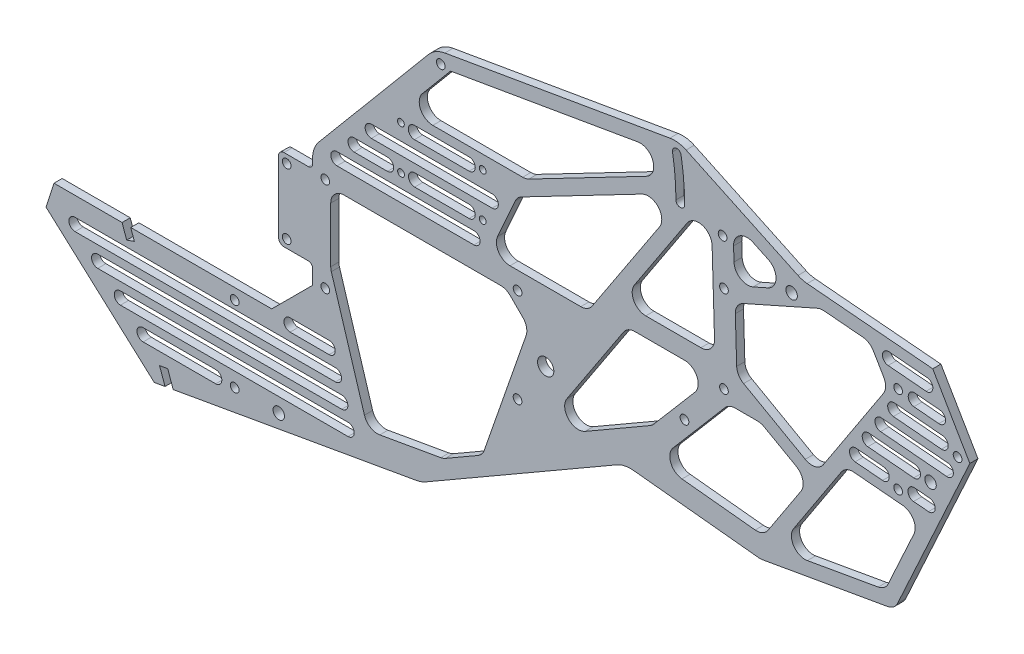
from build123d import *

# Parameters (mm, degrees)
SKETCH1_R           = 1.6
SKETCH1_R_2         = 3
SKETCH1_R_3         = 2.1
BOSS_EXTRUDE1_DEPTH = 3
CUT_EXTRUDE1_DEPTH  = 3
CUT_EXTRUDE2_DEPTH  = 3
SKETCH4_R           = 1.6
SKETCH4_R_2         = 1.25
CUT_EXTRUDE3_DEPTH  = 3
SKETCH5_R           = 1.6
SKETCH5_R_2         = 2.1
CUT_EXTRUDE4_DEPTH  = 3
CUT_EXTRUDE5_DEPTH  = 3
CUT_EXTRUDE6_DEPTH  = 3
FILLET1_R           = 5
FILLET2_R           = 5


with BuildPart() as part:
    # Sketch1 → Boss-Extrude1 (new body)
    with BuildSketch(Plane.XY):
        with BuildLine():
            Line((33.606433282, 69.354528427), (33.606433282, 67.494230769))
            ThreePointArc((33.606433282, 67.494230769), (33.167093454, 66.433570597), (32.106433282, 65.994230769))
            Line((32.106433282, 65.994230769), (23.106433282, 65.994230769))
            ThreePointArc((23.106433282, 65.994230769), (21.692219719, 65.408444332), (21.106433282, 63.994230769))
            Line((21.106433282, 63.994230769), (21.106433282, 37.994230769))
            ThreePointArc((21.106433282, 37.994230769), (21.692219719, 36.580017207), (23.106433282, 35.994230769))
            Line((23.106433282, 35.994230769), (32.106433282, 35.994230769))
            ThreePointArc((32.106433282, 35.994230769), (33.167093454, 35.554890941), (33.606433282, 34.494230769))
            Line((33.606433282, 34.494230769), (33.606433282, 28.994230769))
            Line((33.606433282, 28.994230769), (18.606433282, 13.994230769))
            Line((18.606433282, 13.994230769), (-33.208685877, 13.994230769))
            Line((-33.208685877, 13.994230769), (-31.865678416, 10.226428896))
            Line((-31.865678416, 10.226428896), (-34.691529821, 9.2191733))
            Line((-34.691529821, 9.2191733), (-36.393566718, 13.994230769))
            Line((-36.393566718, 13.994230769), (-61.393566718, 13.994230769))
            Line((-61.393566718, 13.994230769), (-64.338240595, 4.931456458))
            Line((-64.338240595, 4.931456458), (-24.540435349, -31.005769231))
            Line((-24.540435349, -31.005769231), (-20.601204337, -30.31117652))
            Line((-20.601204337, -30.31117652), (-22.615715529, -24.65947371))
            Line((-22.615715529, -24.65947371), (-19.619169292, -24.131101759))
            Line((-19.619169292, -24.131101759), (-17.604658099, -29.782804569))
            Line((-17.604658099, -29.782804569), (71.833626772, -14.012421838))
            ThreePointArc((71.833626772, -14.012421838), (73.517346428, -13.561270516), (75.097144995, -12.824598346))
            Line((75.097144995, -12.824598346), (145.414901265, 27.773377165))
            ThreePointArc((145.414901265, 27.773377165), (148.329156871, 28.893188072), (151.446707108, 29.059749526))
            Line((151.446707108, 29.059749526), (212.432702142, 22.733412992))
            ThreePointArc((212.432702142, 22.733412992), (215.302065541, 21.994439853), (217.828932512, 20.447096669))
            ThreePointArc((217.828932512, 20.447096669), (261.451176936, 21.093233821), (267.109241255, 64.351805341))
            ThreePointArc((267.109241255, 64.351805341), (265.48687235, 69.095784942), (266.370965215, 74.030944831))
            Line((266.370965215, 74.030944831), (275.117398408, 93.06941092))
            Line((275.117398408, 93.06941092), (261.484759484, 116.375014451))
            Line((261.484759484, 116.375014451), (215.3420672, 120.41197693))
            ThreePointArc((215.3420672, 120.41197693), (213.606741864, 120.719693633), (211.952387443, 121.327274937))
            Line((211.952387443, 121.327274937), (170.861805565, 140.682145004))
            ThreePointArc((170.861805565, 140.682145004), (167.944202702, 141.544817238), (164.902224852, 141.490222269))
            Line((164.902224852, 141.490222269), (82.210010789, 127.239213849))
            ThreePointArc((82.210010789, 127.239213849), (78.925127101, 126.054403786), (76.247909886, 123.812363706))
            Line((76.247909886, 123.812363706), (35.945988851, 75.782404523))
            ThreePointArc((35.945988851, 75.782404523), (34.209507074, 72.77472986), (33.606433282, 69.354528427))
        make_face()
        with Locations((5, -17.865711058)):
            Circle(SKETCH1_R, mode=Mode.SUBTRACT)
        with Locations((5, 9.994230769)):
            Circle(SKETCH1_R, mode=Mode.SUBTRACT)
        with Locations((24.106433282, 38.994230769)):
            Circle(SKETCH1_R, mode=Mode.SUBTRACT)
        with Locations((38.27641453, 30.394230769)):
            Circle(SKETCH1_R, mode=Mode.SUBTRACT)
        with Locations((24.106433282, 62.994230769)):
            Circle(SKETCH1_R, mode=Mode.SUBTRACT)
        with Locations((38.27641453, 64.994230769)):
            Circle(SKETCH1_R, mode=Mode.SUBTRACT)
        with Locations((80.724281303, 122.924200116)):
            Circle(SKETCH1_R, mode=Mode.SUBTRACT)
        with Locations((108.936452034, 30.394230769)):
            Circle(SKETCH1_R, mode=Mode.SUBTRACT)
        with Locations((119.266433282, 45.994230769)):
            Circle(SKETCH1_R_2, mode=Mode.SUBTRACT)
        with Locations((108.936452034, 64.994230769)):
            Circle(SKETCH1_R, mode=Mode.SUBTRACT)
        with Locations((21.186685258, -17.865711058)):
            Circle(SKETCH1_R_3, mode=Mode.SUBTRACT)
        with BuildLine():
            Line((-2, -20.135652886), (-28.647304351, -20.135652886))
            ThreePointArc((-28.647304351, -20.135652886), (-30.917246179, -17.865711058), (-28.647304351, -15.595769231))
            Line((-28.647304351, -15.595769231), (-2, -15.595769231))
            ThreePointArc((-2, -15.595769231), (0.269941827, -17.865711058), (-2, -20.135652886))
        make_face(mode=Mode.SUBTRACT)
        with BuildLine():
            Line((46.626657738, -12.605652886), (-36.986219439, -12.605652886))
            ThreePointArc((-36.986219439, -12.605652886), (-39.256161266, -10.335711058), (-36.986219439, -8.065769231))
            Line((-36.986219439, -8.065769231), (46.626657738, -8.065769231))
            ThreePointArc((46.626657738, -8.065769231), (48.896599565, -10.335711058), (46.626657738, -12.605652886))
        make_face(mode=Mode.SUBTRACT)
        with BuildLine():
            Line((44.309159487, -5.075652886), (-45.325134526, -5.075652886))
            ThreePointArc((-45.325134526, -5.075652886), (-47.595076354, -2.805711058), (-45.325134526, -0.535769231))
            Line((-45.325134526, -0.535769231), (44.309159487, -0.535769231))
            ThreePointArc((44.309159487, -0.535769231), (46.579101315, -2.805711058), (44.309159487, -5.075652886))
        make_face(mode=Mode.SUBTRACT)
        with BuildLine():
            Line((41.991661236, 2.454347114), (-53.664049614, 2.454347114))
            ThreePointArc((-53.664049614, 2.454347114), (-55.933991441, 4.724288942), (-53.664049614, 6.994230769))
            Line((-53.664049614, 6.994230769), (41.991661236, 6.994230769))
            ThreePointArc((41.991661236, 6.994230769), (44.261603064, 4.724288942), (41.991661236, 2.454347114))
        make_face(mode=Mode.SUBTRACT)
        with BuildLine():
            Line((39.674162986, 9.984347114), (25.351772829, 9.984347114))
            ThreePointArc((25.351772829, 9.984347114), (23.081831001, 12.254288942), (25.351772829, 14.524230769))
            Line((25.351772829, 14.524230769), (39.674162986, 14.524230769))
            ThreePointArc((39.674162986, 14.524230769), (41.944104813, 12.254288942), (39.674162986, 9.984347114))
        make_face(mode=Mode.SUBTRACT)
        with BuildLine():
            Line((112.062626277, 52.219115126), (96.660010447, 7.956769522))
            ThreePointArc((96.660010447, 7.956769522), (95.790683483, 6.413353898), (94.437758812, 5.269913478))
            Line((94.437758812, 5.269913478), (82.378204185, -1.692673633))
            ThreePointArc((82.378204185, -1.692673633), (81.588304901, -2.061009718), (80.746445073, -2.286585379))
            Line((80.746445073, -2.286585379), (58.320914344, -6.240811503))
            ThreePointArc((58.320914344, -6.240811503), (54.844152372, -5.582404902), (52.673881025, -2.787535434))
            Line((52.673881025, -2.787535434), (40.497622099, 36.775484596))
            ThreePointArc((40.497622099, 36.775484596), (40.332025682, 37.50259487), (40.27641453, 38.246247292))
            Line((40.27641453, 38.246247292), (40.27641453, 58.494230769))
            ThreePointArc((40.27641453, 58.494230769), (41.740880624, 62.029764675), (45.27641453, 63.494230769))
            Line((45.27641453, 63.494230769), (102.708529973, 63.494230769))
            ThreePointArc((102.708529973, 63.494230769), (104.621947134, 63.113628432), (106.244063878, 62.029764675))
            Line((106.244063878, 62.029764675), (110.875908547, 57.397920006))
            ThreePointArc((110.875908547, 57.397920006), (112.214055028, 54.97918487), (112.062626277, 52.219115126))
        make_face(mode=Mode.SUBTRACT)
        with BuildLine():
            ThreePointArc((167.124281303, 122.924200116), (168.724281303, 121.324200116), (170.324281303, 122.924200116))
            ThreePointArc((170.324281303, 122.924200116), (169.998274999, 130.560563753), (169.02262841, 138.141358133))
            ThreePointArc((169.02262841, 138.141358133), (167.174137247, 139.446379366), (165.869116014, 137.597888204))
            ThreePointArc((165.869116014, 137.597888204), (166.809918081, 130.28783648), (167.124281303, 122.924200116))
        make_face(mode=Mode.SUBTRACT)
    extrude(amount=BOSS_EXTRUDE1_DEPTH)

    # Sketch2 → Cut-Extrude1 (cut)
    with BuildSketch(Plane.XY.offset(3)):
        Polygon((151.446707108, 29.059749526), (241.422875717, 19.726139041), (275.117398408, 93.06941092), (318.53181197, -44.262654747), align=None)
    extrude(amount=-CUT_EXTRUDE1_DEPTH, mode=Mode.SUBTRACT)

    # Sketch3 → Cut-Extrude2 (cut)
    with BuildSketch(Plane.XY.offset(3)):
        Polygon((198.229692038, 24.206751611), (247.470079689, 32.889160494), (241.422875717, 19.726139041), align=None)
    extrude(amount=-CUT_EXTRUDE2_DEPTH, mode=Mode.SUBTRACT)

    # Sketch4 → Cut-Extrude3 (cut)
    with BuildSketch(Plane.XY.offset(3)):
        with Locations((184.767611591, 103.568989757)):
            Circle(SKETCH4_R)
        with Locations((184.767611591, 71.568989757)):
            Circle(SKETCH4_R)
        with Locations((248.767611591, 103.568989757)):
            Circle(SKETCH4_R)
        with Locations((248.767611591, 71.568989757)):
            Circle(SKETCH4_R)
        with Locations((66.057748953, 96.994230769)):
            Circle(SKETCH4_R_2)
        with Locations((96.120516229, 96.994230769)):
            Circle(SKETCH4_R_2)
        with Locations((66.120516229, 80.994230769)):
            Circle(SKETCH4_R_2)
        with Locations((96.120516229, 80.994230769)):
            Circle(SKETCH4_R_2)
    extrude(amount=-CUT_EXTRUDE3_DEPTH, mode=Mode.SUBTRACT)

    # Sketch5 → Cut-Extrude4 (cut)
    with BuildSketch(Plane.XY.offset(3)):
        with Locations((184.267611591, 120.119180009)):
            Circle(SKETCH5_R)
        with Locations((170.267611591, 54.568989757)):
            Circle(SKETCH5_R)
        with Locations((270.61335305, 92.847113196)):
            Circle(SKETCH5_R)
        with Locations((209.641360773, 114.61683213)):
            Circle(SKETCH5_R_2)
        with Locations((260.685601414, 79.876300594)):
            Circle(SKETCH5_R_2)
    extrude(amount=-CUT_EXTRUDE4_DEPTH, mode=Mode.SUBTRACT)

    # Sketch6 → Cut-Extrude5 (cut)
    with BuildSketch(Plane.XY.offset(3)):
        with BuildLine():
            Line((134.85979926, 71.494230769), (98.461835392, 71.494230769))
            Line((98.461835392, 71.494230769), (108.765182202, 94.659315822))
            Line((108.765182202, 94.659315822), (154.610313298, 118.522297762))
            ThreePointArc((154.610313298, 118.522297762), (160.630667086, 117.437151644), (161.094872175, 111.337420874))
            Line((161.094872175, 111.337420874), (134.85979926, 71.494230769))
        make_face()
        with BuildLine():
            Line((156.267621783, 125.02173291), (112.027599428, 101.994230769))
            Line((112.027599428, 101.994230769), (67.078173611, 101.994230769))
            Line((67.078173611, 101.994230769), (84.307147675, 122.526922507))
            Line((84.307147675, 122.526922507), (153.109895929, 134.384248566))
            ThreePointArc((153.109895929, 134.384248566), (158.696854523, 131.054814092), (156.267621783, 125.02173291))
        make_face()
        with BuildLine():
            Line((42.565340857, 76.034114424), (92.90473711, 76.034114424))
            ThreePointArc((92.90473711, 76.034114424), (95.174678937, 73.764172597), (92.90473711, 71.494230769))
            Line((92.90473711, 71.494230769), (42.565340857, 71.494230769))
            ThreePointArc((42.565340857, 71.494230769), (40.29539903, 73.764172597), (42.565340857, 76.034114424))
        make_face()
        with BuildLine():
            Line((48.88376108, 83.564114424), (61.120516229, 83.564114424))
            ThreePointArc((61.120516229, 83.564114424), (63.390458057, 81.294172597), (61.120516229, 79.024230769))
            Line((61.120516229, 79.024230769), (48.88376108, 79.024230769))
            ThreePointArc((48.88376108, 79.024230769), (46.613819253, 81.294172597), (48.88376108, 83.564114424))
        make_face()
        with BuildLine():
            Line((71.120516229, 83.564114424), (91.120516229, 83.564114424))
            ThreePointArc((91.120516229, 83.564114424), (93.390458057, 81.294172597), (91.120516229, 79.024230769))
            Line((91.120516229, 79.024230769), (71.120516229, 79.024230769))
            ThreePointArc((71.120516229, 79.024230769), (68.850574402, 81.294172597), (71.120516229, 83.564114424))
        make_face()
        with BuildLine():
            Line((55.202181303, 91.094114424), (99.60311109, 91.094114424))
            ThreePointArc((99.60311109, 91.094114424), (101.873052917, 88.824172597), (99.60311109, 86.554230769))
            Line((99.60311109, 86.554230769), (55.202181303, 86.554230769))
            ThreePointArc((55.202181303, 86.554230769), (52.932239475, 88.824172597), (55.202181303, 91.094114424))
        make_face()
        with BuildLine():
            Line((71.057748953, 98.624114424), (91.120516229, 98.624114424))
            ThreePointArc((91.120516229, 98.624114424), (93.390458057, 96.354172597), (91.120516229, 94.084230769))
            Line((91.120516229, 94.084230769), (71.057748953, 94.084230769))
            ThreePointArc((71.057748953, 94.084230769), (68.787807125, 96.354172597), (71.057748953, 98.624114424))
        make_face()
    extrude(amount=-CUT_EXTRUDE5_DEPTH, mode=Mode.SUBTRACT)

    # Sketch7 → Cut-Extrude6 (cut)
    with BuildSketch(Plane.XY.offset(3)):
        Polygon((146.77250571, 80.494230769), (179.941073241, 130.867315149), (181.462901197, 80.494230769), align=None)
        with BuildLine():
            Line((188.059915073, 127.054422287), (201.041902395, 120.939525239))
            ThreePointArc((201.041902395, 120.939525239), (203.910975235, 116.360652801), (200.9408781, 111.846655152))
            Line((200.9408781, 111.846655152), (188.683829871, 106.402605049))
            Line((188.683829871, 106.402605049), (188.059915073, 127.054422287))
        make_face()
        Polygon((149.347198528, 73.494230769), (181.152339991, 73.494230769), (158.3970747, 46.815643876), (115.455910476, 22.023551152), align=None)
        Polygon((186.61323582, 67.568989757), (159.881003691, 36.227752088), (199.273093613, 32.141443133), (215.978603898, 57.655410206), (198.405633052, 67.568989757), align=None)
        Polygon((188.846926577, 101.004042037), (189.532373469, 78.315489077), (218.72351724, 61.8476574), (245.033539221, 102.03038891), (238.397009778, 113.375831629), (220.271747085, 114.961586638), align=None)
        Polygon((229.537613584, 69.236117232), (204.050540061, 30.310257227), (244.02074034, 37.358081961), (257.540269046, 66.78620233), align=None)
        with BuildLine():
            Line((245.485793121, 113.759463286), (259.457759132, 112.537074652))
            ThreePointArc((259.457759132, 112.537074652), (261.52122468, 110.077932173), (259.0620822, 108.014466626))
            Line((259.0620822, 108.014466626), (245.090116189, 109.236855259))
            ThreePointArc((245.090116189, 109.236855259), (243.026650642, 111.695997738), (245.485793121, 113.759463286))
        make_face()
        with BuildLine():
            Line((254.9479879, 105.372865134), (264.117748628, 104.570615023))
            ThreePointArc((264.117748628, 104.570615023), (266.181214175, 102.111472543), (263.722071696, 100.048006996))
            Line((263.722071696, 100.048006996), (254.552310968, 100.850257107))
            ThreePointArc((254.552310968, 100.850257107), (252.488845421, 103.309399586), (254.9479879, 105.372865134))
        make_face()
        with BuildLine():
            Line((247.398983869, 98.474554031), (265.0932758, 96.926504077))
            ThreePointArc((265.0932758, 96.926504077), (267.156741347, 94.467361598), (264.697598868, 92.403896051))
            Line((264.697598868, 92.403896051), (247.003306937, 93.951946004))
            ThreePointArc((247.003306937, 93.951946004), (244.939841389, 96.411088483), (247.398983869, 98.474554031))
        make_face()
        with BuildLine():
            Line((242.717960226, 91.325327156), (266.996884147, 89.201196551))
            ThreePointArc((266.996884147, 89.201196551), (269.060349694, 86.742054071), (266.601207215, 84.678588524))
            Line((266.601207215, 84.678588524), (242.322283294, 86.802719129))
            ThreePointArc((242.322283294, 86.802719129), (240.258817747, 89.261861609), (242.717960226, 91.325327156))
        make_face()
        with BuildLine():
            Line((238.036936584, 84.176100282), (254.909847116, 82.69991189))
            ThreePointArc((254.909847116, 82.69991189), (256.973312663, 80.24076941), (254.514170184, 78.177303863))
            Line((254.514170184, 78.177303863), (237.641259652, 79.653492255))
            ThreePointArc((237.641259652, 79.653492255), (235.577794105, 82.112634735), (238.036936584, 84.176100282))
        make_face()
        with BuildLine():
            Line((233.355912942, 77.026873408), (243.430122897, 76.145494243))
            ThreePointArc((243.430122897, 76.145494243), (245.493588444, 73.686351763), (243.034445965, 71.622886216))
            Line((243.034445965, 71.622886216), (232.96023601, 72.504265381))
            ThreePointArc((232.96023601, 72.504265381), (230.896770462, 74.96340786), (233.355912942, 77.026873408))
        make_face()
        with BuildLine():
            Line((254.818713503, 75.149121671), (260.320123117, 74.667810696))
            ThreePointArc((260.320123117, 74.667810696), (262.383588665, 72.208668217), (259.924446185, 70.14520267))
            Line((259.924446185, 70.14520267), (254.423036571, 70.626513644))
            ThreePointArc((254.423036571, 70.626513644), (252.359571024, 73.085656124), (254.818713503, 75.149121671))
        make_face()
    extrude(amount=-CUT_EXTRUDE6_DEPTH, mode=Mode.SUBTRACT)

    # Fillet1
    fillet1_edges = [part.edges().sort_by_distance(p)[0] for p in [
        (204.050540061, 30.310257227, 1.5),
        (186.61323582, 67.568989757, 1.5),
        (198.405633052, 67.568989757, 1.5),
        (229.537613584, 69.236117232, 1.5),
        (199.273093613, 32.141443133, 1.5),
        (244.02074034, 37.358081961, 1.5),
        (218.72351724, 61.8476574, 1.5),
        (257.540269046, 66.78620233, 1.5),
        (245.033539221, 102.03038891, 1.5),
        (238.397009778, 113.375831629, 1.5),
        (188.846926577, 101.004042037, 1.5),
        (220.271747085, 114.961586638, 1.5),
        (189.532373469, 78.315489077, 1.5),
        (159.881003691, 36.227752088, 1.5),
        (115.455910476, 22.023551152, 1.5),
        (158.3970747, 46.815643876, 1.5),
        (181.152339991, 73.494230769, 1.5),
        (149.347198528, 73.494230769, 1.5),
        (188.683829871, 106.402605049, 1.5),
        (188.059915073, 127.054422287, 1.5),
        (181.462901197, 80.494230769, 1.5),
        (179.941073241, 130.867315149, 1.5),
        (146.77250571, 80.494230769, 1.5),
        (134.85979926, 71.494230769, 1.5),
        (98.461835392, 71.494230769, 1.5),
        (108.765182202, 94.659315822, 1.5),
        (67.078173611, 101.994230769, 1.5),
        (215.978603898, 57.655410206, 1.5),
        (112.027599428, 101.994230769, 1.5),
    ]]
    fillet(fillet1_edges, radius=FILLET1_R)

    # Fillet2
    fillet2_edges = [part.edges().sort_by_distance(p)[0] for p in [
        (198.229692038, 24.206751611, 1.5),
        (247.470079689, 32.889160494, 1.5),
    ]]
    fillet(fillet2_edges, radius=FILLET2_R)


solid = part.part
